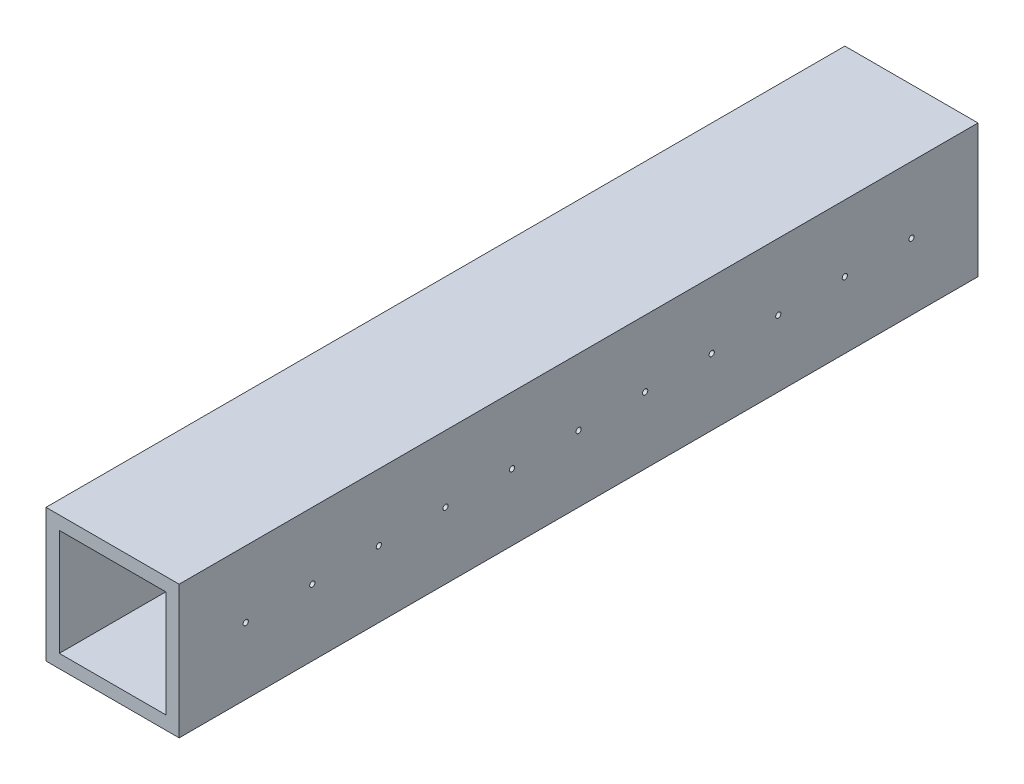
from build123d import *

# Parameters (mm, degrees)
SKETCH1_W               = 25.4
SKETCH1_H               = 25.4
SKETCH1_W_2             = 20.32
SKETCH1_H_2             = 20.32
BOSS_EXTRUDE1_DEPTH     = 152.4
CUT_EXTRUDE1_DEPTH      = 156.094913449
CUT_EXTRUDE1_DEPTH_BACK = 156.094913449
SKETCH2_R               = 0.5


with BuildPart() as part:
    # Sketch1 → Boss-Extrude1 (new body)
    with BuildSketch(Plane.XY):
        with Locations((12.216190476, 0.846666667)):
            Rectangle(SKETCH1_W, SKETCH1_H)
        with Locations((12.216190476, 0.846666667)):
            Rectangle(SKETCH1_W_2, SKETCH1_H_2, mode=Mode.SUBTRACT)
    extrude(amount=BOSS_EXTRUDE1_DEPTH)

    # Sketch2 → Cut-Extrude1 (cut, two sides: drawn at the far end of the back side and taken through both)
    with BuildSketch(Plane(origin=(24.916190476, 0, 0), x_dir=(0, 0, -1), z_dir=(1, 0, 0)).offset(-CUT_EXTRUDE1_DEPTH_BACK)):
        with Locations((-139.7, 0.846666667)):
            Circle(SKETCH2_R)
        with Locations((-127, 0.846666667)):
            Circle(SKETCH2_R)
        with Locations((-114.3, 0.846666667)):
            Circle(SKETCH2_R)
        with Locations((-101.6, 0.846666667)):
            Circle(SKETCH2_R)
        with Locations((-88.9, 0.846666667)):
            Circle(SKETCH2_R)
        with Locations((-76.2, 0.846666667)):
            Circle(SKETCH2_R)
        with Locations((-63.5, 0.846666667)):
            Circle(SKETCH2_R)
        with Locations((-50.8, 0.846666667)):
            Circle(SKETCH2_R)
        with Locations((-38.1, 0.846666667)):
            Circle(SKETCH2_R)
        with Locations((-25.4, 0.846666667)):
            Circle(SKETCH2_R)
        with Locations((-12.7, 0.846666667)):
            Circle(SKETCH2_R)
    extrude(amount=CUT_EXTRUDE1_DEPTH + CUT_EXTRUDE1_DEPTH_BACK, mode=Mode.SUBTRACT)


solid = part.part
